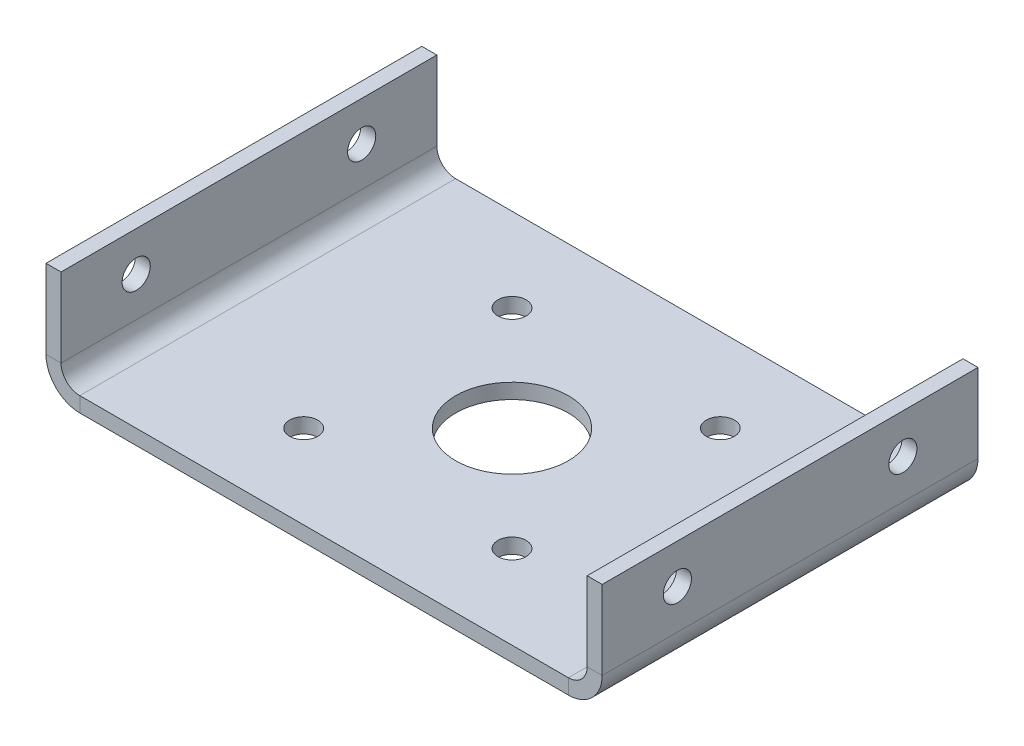
from build123d import *

# Parameters (mm, degrees)
SKETCH1_W                      = 296
SKETCH1_H                      = 200
BASE_FLANGE1_DEPTH             = 8
EDGE_FLANGE1_STRIP_W           = 52
EDGE_FLANGE1_STRIP_H           = 8
EDGE_FLANGE1_STRIP_CUT_DEPTH   = 200
EDGE_FLANGE1_STRIP_2_W         = 52
EDGE_FLANGE1_STRIP_2_H         = 8
EDGE_FLANGE1_STRIP_CUT_2_DEPTH = 200
EDGE_FLANGE1_DEPTH             = 200
EDGE_FLANGE1_BEND_DEPTH        = 200
SKETCH12_R                     = 30
CUT_EXTRUDE1_DEPTH             = 10
SKETCH13_R                     = 7.5
CUT_EXTRUDE2_DEPTH             = 10
SKETCH15_R                     = 7.5
CUT_EXTRUDE3_DEPTH             = 317.733326317
MIRROR5_COPY_1_SKETCH_R        = 7.5
MIRROR5_COPY_1_DEPTH           = 10


# Sheet-metal steps are written as plain solids
with BuildPart() as part:
    # Sketch1 → Base-Flange1 (new body)
    with BuildSketch(Plane(origin=(0, 0, 0), x_dir=(1, 0, 0), z_dir=(0, 1, 0))):
        Rectangle(SKETCH1_W, SKETCH1_H)
    extrude(amount=-BASE_FLANGE1_DEPTH)

    # Edge-Flange1 strip (across the edge) → Edge-Flange1 strip cut (cut)
    with BuildSketch(Plane(origin=(-148, 0, -100), x_dir=(1, 0, 0), z_dir=(0, 0, 1))):
        with Locations((-8, -4)):
            Rectangle(EDGE_FLANGE1_STRIP_W, EDGE_FLANGE1_STRIP_H)
    extrude(amount=EDGE_FLANGE1_STRIP_CUT_DEPTH, mode=Mode.SUBTRACT)

    # Edge-Flange1 strip 2 (across the edge) → Edge-Flange1 strip cut 2 (cut)
    with BuildSketch(Plane(origin=(148, 0, 100), x_dir=(-1, 0, 0), z_dir=(0, 0, -1))):
        with Locations((-8, -4)):
            Rectangle(EDGE_FLANGE1_STRIP_2_W, EDGE_FLANGE1_STRIP_2_H)
    extrude(amount=EDGE_FLANGE1_STRIP_CUT_2_DEPTH, mode=Mode.SUBTRACT)

    # Edge-Flange1 section (across the edge) → Edge-Flange1 (add)
    with BuildSketch(Plane(origin=(-148, 0, -100), x_dir=(1, 0, 0), z_dir=(0, 0, 1))):
        with BuildLine():
            Line((0, 10), (0, 52))
            Line((0, 52), (8, 52))
            Line((8, 52), (8, 10))
            ThreePointArc((8, 10), (10.928932188, 2.928932188), (18, 0))
            Line((18, 0), (18, -8))
            ThreePointArc((18, -8), (5.272077939, -2.727922061), (0, 10))
        make_face()
    extrude(amount=EDGE_FLANGE1_DEPTH)

    # Edge-Flange1 section 2 (across the edge) → Edge-Flange1 bend (add)
    with BuildSketch(Plane(origin=(148, 0, 100), x_dir=(-1, 0, 0), z_dir=(0, 0, -1))):
        with BuildLine():
            Line((0, 10), (0, 52))
            Line((0, 52), (8, 52))
            Line((8, 52), (8, 10))
            ThreePointArc((8, 10), (10.928932188, 2.928932188), (18, 0))
            Line((18, 0), (18, -8))
            ThreePointArc((18, -8), (5.272077939, -2.727922061), (0, 10))
        make_face()
    extrude(amount=EDGE_FLANGE1_BEND_DEPTH)

    # Sketch12 → Cut-Extrude1 (cut)
    with BuildSketch(Plane(origin=(0, -8, 0), x_dir=(-1, 0, 0), z_dir=(0, -1, 0))):
        with Locations(Location((0, 0, 0), (0, 0, 90))):
            Circle(SKETCH12_R)
    extrude(amount=-CUT_EXTRUDE1_DEPTH, mode=Mode.SUBTRACT)

    # Sketch13 → Cut-Extrude2 (cut)
    with BuildSketch(Plane(origin=(0, -8, 0), x_dir=(-1, 0, 0), z_dir=(0, -1, 0))):
        with Locations(Location((55.437171645, -55.437171645, 0), (0, 0, 90))):
            Circle(SKETCH13_R)
    cut_extrude2 = extrude(amount=-CUT_EXTRUDE2_DEPTH, mode=Mode.SUBTRACT)

    # Mirror4: Cut-Extrude2 across plane
    add(cut_extrude2.mirror(Plane(origin=(0, 0, 0), x_dir=(0, 0, 1), z_dir=(1, 0, 0))), mode=Mode.SUBTRACT)

    # Sketch15 → Cut-Extrude3 (cut, through all)
    with BuildSketch(Plane.ZY.offset(148)):
        with Locations(Location((-60, 31, 0), (0, 0, 270))):
            Circle(SKETCH15_R)
    cut_extrude3 = extrude(amount=-CUT_EXTRUDE3_DEPTH, mode=Mode.SUBTRACT)

    # Mirror5: Cut-Extrude2, Cut-Extrude3 across plane
    add(cut_extrude2.mirror(Plane.XY), mode=Mode.SUBTRACT)
    add(cut_extrude3.mirror(Plane.XY), mode=Mode.SUBTRACT)

    # Mirror5 copy 1 sketch → Mirror5 copy 1 (cut)
    with BuildSketch(Plane.XZ.offset(8)):
        with Locations(Location((55.437171645, -55.437171645, 0), (0, 0, 90))):
            Circle(MIRROR5_COPY_1_SKETCH_R)
    extrude(amount=-MIRROR5_COPY_1_DEPTH, mode=Mode.SUBTRACT)


solid = part.part
